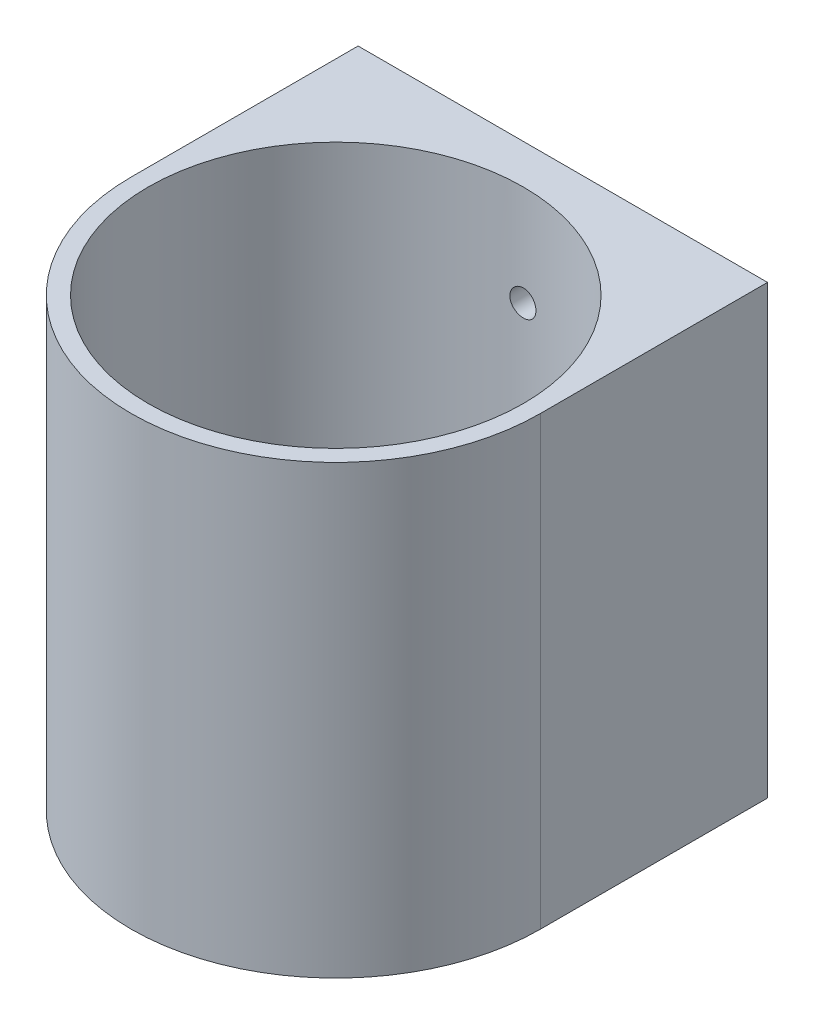
from build123d import *

# Parameters (mm, degrees)
SKETCH1_R                = 25.2
BOSS_EXTRUDE2_DEPTH      = 60
SKETCH3_R                = 25.2
BOSS_EXTRUDE3_DEPTH      = 9.3
SKETCH4_R                = 1.75
CUT_EXTRUDE1_DEPTH       = 81.850096247
MOUNTING_START           = -16.463815789
MOUNTING_HOLES_OUTLINE_R = 1.75
MOUNTING_HOLES_DEPTH     = 7.360837397
SKETCH5_W                = 55
SKETCH5_H                = 60
SKETCH5_R                = 1.75
HEIGHT_DECREASE_DEPTH    = 2


# Read off the part's stored shape, not the designer's step: mounting holes
with BuildPart() as part:
    # Sketch1 → Boss-Extrude2 (new body)
    with BuildSketch(Plane(origin=(0, 0, 0), x_dir=(1, 0, 0), z_dir=(0, 1, 0))):
        with BuildLine():
            Line((9.493421053, 16.463815789), (-45.506578947, 16.463815789))
            Line((-45.506578947, 16.463815789), (-45.506578947, -16.036184211))
            ThreePointArc((-45.506578947, -16.036184211), (-18.006578947, -43.536184211), (9.493421053, -16.036184211))
            Line((9.493421053, -16.036184211), (9.493421053, 16.463815789))
        make_face()
        with Locations(Location((-18.006578947, -16.036184211, 0), (0, 0, 270))):
            Circle(SKETCH1_R, mode=Mode.SUBTRACT)
    extrude(amount=BOSS_EXTRUDE2_DEPTH)

    # Sketch3 → Boss-Extrude3 (add)
    with BuildSketch(Plane(origin=(0, 0, 0), x_dir=(-1, 0, 0), z_dir=(0, -1, 0))):
        with Locations(Location((18.006578947, -16.036184211, 0), (0, 0, 90))):
            Circle(SKETCH3_R)
    extrude(amount=-BOSS_EXTRUDE3_DEPTH)

    # Sketch4 → Cut-Extrude1 (cut, through all)
    with BuildSketch(Plane(origin=(0, 9.3, 0), x_dir=(1, 0, 0), z_dir=(0, 1, 0))):
        with BuildLine():
            ThreePointArc((-18.006578947, 5.713815789), (-19.756578947, 3.963815789), (-18.006578947, 2.213815789))
            Line((-18.006578947, 2.213815789), (-18.006578947, 5.713815789))
        make_face()
        with BuildLine():
            Line((-18.006578947, 5.713815789), (-18.006578947, 2.213815789))
            ThreePointArc((-18.006578947, 2.213815789), (-16.76914208, 2.726378922), (-16.256578947, 3.963815789))
            ThreePointArc((-16.256578947, 3.963815789), (-16.76914208, 5.201252657), (-18.006578947, 5.713815789))
        make_face()
        with BuildLine():
            ThreePointArc((-18.006578947, -4.286184211), (-19.756578947, -6.036184211), (-18.006578947, -7.786184211))
            Line((-18.006578947, -7.786184211), (-18.006578947, -4.286184211))
        make_face()
        with BuildLine():
            Line((-18.006578947, -4.286184211), (-18.006578947, -7.786184211))
            ThreePointArc((-18.006578947, -7.786184211), (-16.76914208, -7.273621078), (-16.256578947, -6.036184211))
            ThreePointArc((-16.256578947, -6.036184211), (-16.76914208, -4.798747343), (-18.006578947, -4.286184211))
        make_face()
        with Locations(Location((-28.006578947, -6.036184211, 0), (0, 0, 270))):
            Circle(SKETCH4_R)
        with Locations(Location((-8.006578947, -6.036184211, 0), (0, 0, 270))):
            Circle(SKETCH4_R)
        with BuildLine():
            ThreePointArc((-6.256578947, -16.036184211), (-8.006578947, -14.286184211), (-9.756578947, -16.036184211))
            Line((-9.756578947, -16.036184211), (-6.256578947, -16.036184211))
        make_face()
        with BuildLine():
            Line((-6.256578947, -16.036184211), (-9.756578947, -16.036184211))
            ThreePointArc((-9.756578947, -16.036184211), (-8.006578947, -17.786184211), (-6.256578947, -16.036184211))
        make_face()
        with BuildLine():
            ThreePointArc((3.743421053, -16.036184211), (1.993421053, -14.286184211), (0.243421053, -16.036184211))
            Line((0.243421053, -16.036184211), (3.743421053, -16.036184211))
        make_face()
        with BuildLine():
            Line((3.743421053, -16.036184211), (0.243421053, -16.036184211))
            ThreePointArc((0.243421053, -16.036184211), (1.993421053, -17.786184211), (3.743421053, -16.036184211))
        make_face()
        with BuildLine():
            ThreePointArc((-19.756578947, -16.036184211), (-19.244015814, -17.273621078), (-18.006578947, -17.786184211))
            Line((-18.006578947, -17.786184211), (-18.006578947, -16.036184211))
            Line((-18.006578947, -16.036184211), (-19.756578947, -16.036184211))
        make_face()
        with BuildLine():
            Line((-18.006578947, -16.036184211), (-18.006578947, -17.786184211))
            ThreePointArc((-18.006578947, -17.786184211), (-16.76914208, -17.273621078), (-16.256578947, -16.036184211))
            Line((-16.256578947, -16.036184211), (-18.006578947, -16.036184211))
        make_face()
        with BuildLine():
            Line((-19.756578947, -16.036184211), (-18.006578947, -16.036184211))
            Line((-18.006578947, -16.036184211), (-18.006578947, -14.286184211))
            ThreePointArc((-18.006578947, -14.286184211), (-19.244015814, -14.798747343), (-19.756578947, -16.036184211))
        make_face()
        with BuildLine():
            Line((-18.006578947, -14.286184211), (-18.006578947, -16.036184211))
            Line((-18.006578947, -16.036184211), (-16.256578947, -16.036184211))
            ThreePointArc((-16.256578947, -16.036184211), (-16.76914208, -14.798747343), (-18.006578947, -14.286184211))
        make_face()
        with BuildLine():
            ThreePointArc((-39.756578947, -16.036184211), (-38.006578947, -17.786184211), (-36.256578947, -16.036184211))
            Line((-36.256578947, -16.036184211), (-39.756578947, -16.036184211))
        make_face()
        with BuildLine():
            Line((-39.756578947, -16.036184211), (-36.256578947, -16.036184211))
            ThreePointArc((-36.256578947, -16.036184211), (-38.006578947, -14.286184211), (-39.756578947, -16.036184211))
        make_face()
        with Locations(Location((-28.006578947, -26.036184211, 0), (0, 0, 270))):
            Circle(SKETCH4_R)
        with BuildLine():
            ThreePointArc((-18.006578947, -24.286184211), (-19.756578947, -26.036184211), (-18.006578947, -27.786184211))
            Line((-18.006578947, -27.786184211), (-18.006578947, -24.286184211))
        make_face()
        with BuildLine():
            Line((-18.006578947, -24.286184211), (-18.006578947, -27.786184211))
            ThreePointArc((-18.006578947, -27.786184211), (-16.76914208, -27.273621078), (-16.256578947, -26.036184211))
            ThreePointArc((-16.256578947, -26.036184211), (-16.76914208, -24.798747343), (-18.006578947, -24.286184211))
        make_face()
        with Locations(Location((-8.006578947, -26.036184211, 0), (0, 0, 270))):
            Circle(SKETCH4_R)
        with BuildLine():
            ThreePointArc((-18.006578947, -34.286184211), (-19.756578947, -36.036184211), (-18.006578947, -37.786184211))
            Line((-18.006578947, -37.786184211), (-18.006578947, -34.286184211))
        make_face()
        with BuildLine():
            Line((-18.006578947, -34.286184211), (-18.006578947, -37.786184211))
            ThreePointArc((-18.006578947, -37.786184211), (-16.76914208, -37.273621078), (-16.256578947, -36.036184211))
            ThreePointArc((-16.256578947, -36.036184211), (-16.76914208, -34.798747343), (-18.006578947, -34.286184211))
        make_face()
        with BuildLine():
            ThreePointArc((-29.756578947, -16.036184211), (-28.006578947, -17.786184211), (-26.256578947, -16.036184211))
            Line((-26.256578947, -16.036184211), (-29.756578947, -16.036184211))
        make_face()
        with BuildLine():
            Line((-29.756578947, -16.036184211), (-26.256578947, -16.036184211))
            ThreePointArc((-26.256578947, -16.036184211), (-28.006578947, -14.286184211), (-29.756578947, -16.036184211))
        make_face()
        with Locations(Location((-33.006578947, -11.036184211, 0), (0, 0, 270))):
            Circle(SKETCH4_R)
        with Locations(Location((-28.006578947, -11.036184211, 0), (0, 0, 270))):
            Circle(SKETCH4_R)
        with Locations(Location((-23.006578947, -11.036184211, 0), (0, 0, 270))):
            Circle(SKETCH4_R)
        with Locations(Location((-23.006578947, -6.036184211, 0), (0, 0, 270))):
            Circle(SKETCH4_R)
        with Locations(Location((-23.006578947, -1.036184211, 0), (0, 0, 270))):
            Circle(SKETCH4_R)
        with Locations(Location((-18.006578947, -1.036184211, 0), (0, 0, 270))):
            Circle(SKETCH4_R)
        with Locations(Location((-13.006578947, -1.036184211, 0), (0, 0, 270))):
            Circle(SKETCH4_R)
        with Locations(Location((-13.006578947, -6.036184211, 0), (0, 0, 270))):
            Circle(SKETCH4_R)
        with Locations(Location((-13.006578947, -11.036184211, 0), (0, 0, 270))):
            Circle(SKETCH4_R)
        with Locations(Location((-8.006578947, -11.036184211, 0), (0, 0, 270))):
            Circle(SKETCH4_R)
        with Locations(Location((-3.006578947, -11.036184211, 0), (0, 0, 270))):
            Circle(SKETCH4_R)
        with Locations(Location((-3.118703261, -16.036184211, 0), (0, 0, 270))):
            Circle(SKETCH4_R)
        with Locations(Location((-3.006578947, -21.036184211, 0), (0, 0, 270))):
            Circle(SKETCH4_R)
        with Locations(Location((-8.006578947, -21.036184211, 0), (0, 0, 270))):
            Circle(SKETCH4_R)
        with Locations(Location((-13.006578947, -21.036184211, 0), (0, 0, 270))):
            Circle(SKETCH4_R)
        with Locations(Location((-13.006578947, -16.036184211, 0), (0, 0, 270))):
            Circle(SKETCH4_R)
        with Locations(Location((-18.006578947, -11.036184211, 0), (0, 0, 270))):
            Circle(SKETCH4_R)
        with Locations(Location((-23.006578947, -16.036184211, 0), (0, 0, 270))):
            Circle(SKETCH4_R)
        with Locations(Location((-33.04333339, -16.036184211, 0), (0, 0, 270))):
            Circle(SKETCH4_R)
        with Locations(Location((-33.006578947, -21.036184211, 0), (0, 0, 270))):
            Circle(SKETCH4_R)
        with Locations(Location((-28.006578947, -21.036184211, 0), (0, 0, 270))):
            Circle(SKETCH4_R)
        with Locations(Location((-23.006578947, -21.036184211, 0), (0, 0, 270))):
            Circle(SKETCH4_R)
        with Locations(Location((-18.006578947, -21.036184211, 0), (0, 0, 270))):
            Circle(SKETCH4_R)
        with Locations(Location((-13.006578947, -31.036184211, 0), (0, 0, 270))):
            Circle(SKETCH4_R)
        with Locations(Location((-18.006578947, -31.036184211, 0), (0, 0, 270))):
            Circle(SKETCH4_R)
        with Locations(Location((-23.006578947, -31.036184211, 0), (0, 0, 270))):
            Circle(SKETCH4_R)
        with Locations(Location((-23.006578947, -26.036184211, 0), (0, 0, 270))):
            Circle(SKETCH4_R)
        with Locations(Location((-13.006578947, -26.036184211, 0), (0, 0, 270))):
            Circle(SKETCH4_R)
    extrude(amount=-CUT_EXTRUDE1_DEPTH, mode=Mode.SUBTRACT)

    # mounting holes outline → mounting holes (cut)
    with BuildSketch(Plane.XY.offset(MOUNTING_START)):
        with Locations((-18.006578947, 13.5)):
            Circle(MOUNTING_HOLES_OUTLINE_R)
        with Locations((-18.006578947, 46.5)):
            Circle(MOUNTING_HOLES_OUTLINE_R)
    extrude(amount=MOUNTING_HOLES_DEPTH, mode=Mode.SUBTRACT)

    # Sketch5 → height decrease (cut)
    with BuildSketch(Plane(origin=(0, 0, -16.463815789), x_dir=(-1, 0, 0), z_dir=(0, 0, -1))):
        with Locations((18.006578947, 30)):
            Rectangle(SKETCH5_W, SKETCH5_H)
        with Locations((18.006578947, 46.5)):
            Circle(SKETCH5_R, mode=Mode.SUBTRACT)
        with Locations((18.006578947, 13.5)):
            Circle(SKETCH5_R, mode=Mode.SUBTRACT)
    extrude(amount=-HEIGHT_DECREASE_DEPTH, mode=Mode.SUBTRACT)


solid = part.part
